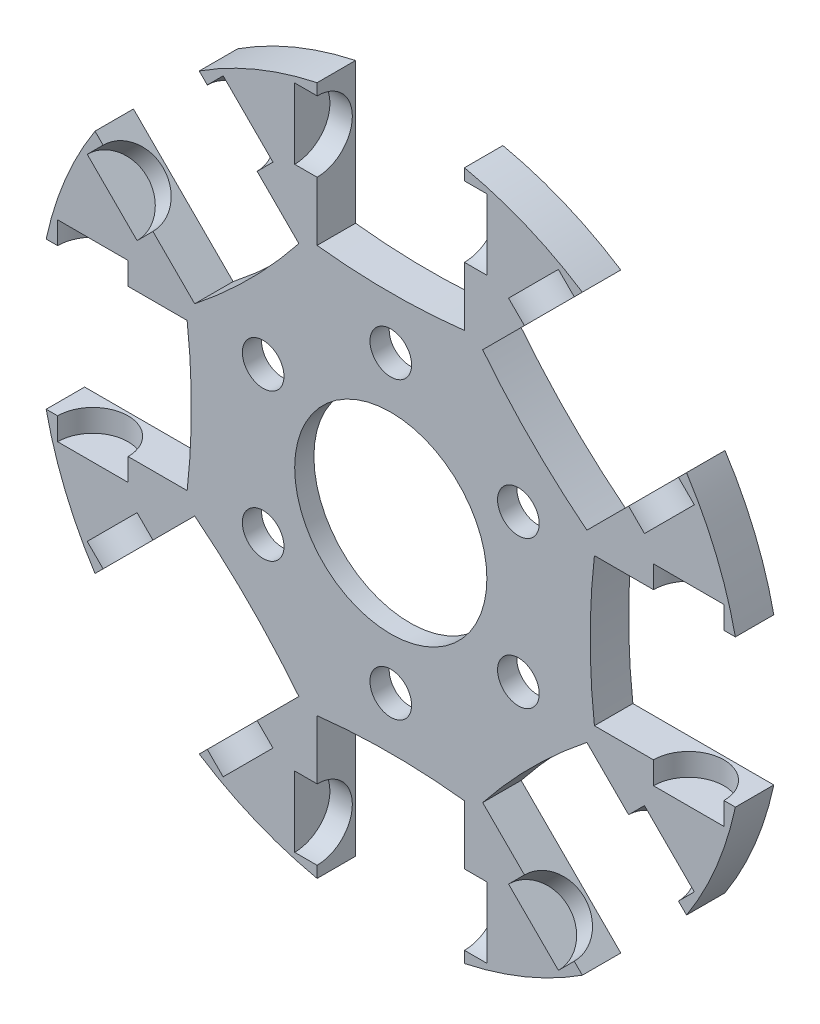
from build123d import *

# Parameters (mm, degrees)
SKETCH2_R           = 1.625
SKETCH2_R_2         = 7.5
BOSS_EXTRUDE2_DEPTH = 3
SKETCH2_4_R         = 14
SKETCH2_4_R_2       = 1.625
SKETCH2_4_R_3       = 7.5
BOSS_EXTRUDE3_DEPTH = 3
SKETCH3_W           = 15
SKETCH3_H           = 2.75
SKETCH5_R           = 15.5
CUT_EXTRUDE2_DEPTH  = 1.5
CIRPATTERN2_COUNT   = 8


with BuildPart() as part:
    # Sketch2 → Boss-Extrude2 (new body)
    with BuildSketch(Plane.XY):
        with BuildLine():
            Line((-5.75, 15.892145693), (-5.75, 26.892145693))
            ThreePointArc((-5.75, 26.892145693), (-10.52379439, 25.406687144), (-14.949754589, 23.081482572))
            Line((-14.949754589, 23.081482572), (-7.171579996, 15.303307979))
            ThreePointArc((-7.171579996, 15.303307979), (-11.002878695, 11.002878695), (-15.303307979, 7.171579996))
            Line((-15.303307979, 7.171579996), (-23.081482572, 14.949754589))
            ThreePointArc((-23.081482572, 14.949754589), (-25.406687144, 10.52379439), (-26.892145693, 5.75))
            Line((-26.892145693, 5.75), (-15.892145693, 5.75))
            ThreePointArc((-15.892145693, 5.75), (-15.560420276, 0), (-15.892145693, -5.75))
            Line((-15.892145693, -5.75), (-26.892145693, -5.75))
            ThreePointArc((-26.892145693, -5.75), (-25.406687144, -10.52379439), (-23.081482572, -14.949754589))
            Line((-23.081482572, -14.949754589), (-15.303307979, -7.171579996))
            ThreePointArc((-15.303307979, -7.171579996), (-11.002878695, -11.002878695), (-7.171579996, -15.303307979))
            Line((-7.171579996, -15.303307979), (-14.949754589, -23.081482572))
            ThreePointArc((-14.949754589, -23.081482572), (-10.52379439, -25.406687144), (-5.75, -26.892145693))
            Line((-5.75, -26.892145693), (-5.75, -15.892145693))
            ThreePointArc((-5.75, -15.892145693), (0, -15.560420276), (5.75, -15.892145693))
            Line((5.75, -15.892145693), (5.75, -26.892145693))
            ThreePointArc((5.75, -26.892145693), (10.52379439, -25.406687144), (14.949754589, -23.081482572))
            Line((14.949754589, -23.081482572), (7.171579996, -15.303307979))
            ThreePointArc((7.171579996, -15.303307979), (11.002878695, -11.002878695), (15.303307979, -7.171579996))
            Line((15.303307979, -7.171579996), (23.081482572, -14.949754589))
            ThreePointArc((23.081482572, -14.949754589), (25.406687144, -10.52379439), (26.892145693, -5.75))
            Line((26.892145693, -5.75), (15.892145693, -5.75))
            ThreePointArc((15.892145693, -5.75), (15.560420276, 0), (15.892145693, 5.75))
            Line((15.892145693, 5.75), (26.892145693, 5.75))
            ThreePointArc((26.892145693, 5.75), (25.406687144, 10.52379439), (23.081482572, 14.949754589))
            Line((23.081482572, 14.949754589), (15.303307979, 7.171579996))
            ThreePointArc((15.303307979, 7.171579996), (11.002878695, 11.002878695), (7.171579996, 15.303307979))
            Line((7.171579996, 15.303307979), (14.949754589, 23.081482572))
            ThreePointArc((14.949754589, 23.081482572), (10.52379439, 25.406687144), (5.75, 26.892145693))
            Line((5.75, 26.892145693), (5.75, 15.892145693))
            ThreePointArc((5.75, 15.892145693), (0, 15.560420276), (-5.75, 15.892145693))
        make_face()
        with Locations((0, 11.5)):
            Circle(SKETCH2_R, mode=Mode.SUBTRACT)
        with Locations((-9.959292144, -5.75)):
            Circle(SKETCH2_R, mode=Mode.SUBTRACT)
        with Locations((0, -11.5)):
            Circle(SKETCH2_R, mode=Mode.SUBTRACT)
        with Locations((9.959292144, -5.75)):
            Circle(SKETCH2_R, mode=Mode.SUBTRACT)
        with Locations((-9.959292144, 5.75)):
            Circle(SKETCH2_R, mode=Mode.SUBTRACT)
        Circle(SKETCH2_R_2, mode=Mode.SUBTRACT)
        with Locations((9.959292144, 5.75)):
            Circle(SKETCH2_R, mode=Mode.SUBTRACT)
    extrude(amount=BOSS_EXTRUDE2_DEPTH)

    # Sketch2<4> → Boss-Extrude3 (add)
    with BuildSketch(Plane.XY):
        Circle(SKETCH2_4_R)
        with Locations((-9.959292144, -5.75)):
            Circle(SKETCH2_4_R_2, mode=Mode.SUBTRACT)
        with Locations((0, -11.5)):
            Circle(SKETCH2_4_R_2, mode=Mode.SUBTRACT)
        with Locations((9.959292144, -5.75)):
            Circle(SKETCH2_4_R_2, mode=Mode.SUBTRACT)
        with Locations((-9.959292144, 5.75)):
            Circle(SKETCH2_4_R_2, mode=Mode.SUBTRACT)
        Circle(SKETCH2_4_R_3, mode=Mode.SUBTRACT)
        with Locations((9.959292144, 5.75)):
            Circle(SKETCH2_4_R_2, mode=Mode.SUBTRACT)
        with Locations((0, 11.5)):
            Circle(SKETCH2_4_R_2, mode=Mode.SUBTRACT)
    extrude(amount=BOSS_EXTRUDE3_DEPTH)

    # Sketch3 → Cut-Revolve1 (revolve, cut)
    with BuildSketch(Plane.XY.offset(3)):
        with Locations((0, 24.625)):
            Rectangle(SKETCH3_W, SKETCH3_H)
    cut_revolve1 = revolve(axis=Axis((7.5, 23.25, 3), (-1, 0, 0)), mode=Mode.SUBTRACT)

    # Sketch5 → Cut-Extrude2 (cut)
    with BuildSketch(Plane(origin=(0, 0, 0), x_dir=(-1, 0, 0), z_dir=(0, 0, -1))):
        Circle(SKETCH5_R)
    extrude(amount=-CUT_EXTRUDE2_DEPTH, mode=Mode.SUBTRACT)

    # CirPattern2: Cut-Revolve1 ×8 about axis
    cirpattern2_axis = Axis((0, 0, 3), (0, 0, 1))
    for i in range(1, CIRPATTERN2_COUNT):
        add(cut_revolve1.rotate(cirpattern2_axis, i * 360 / CIRPATTERN2_COUNT), mode=Mode.SUBTRACT)


solid = part.part
